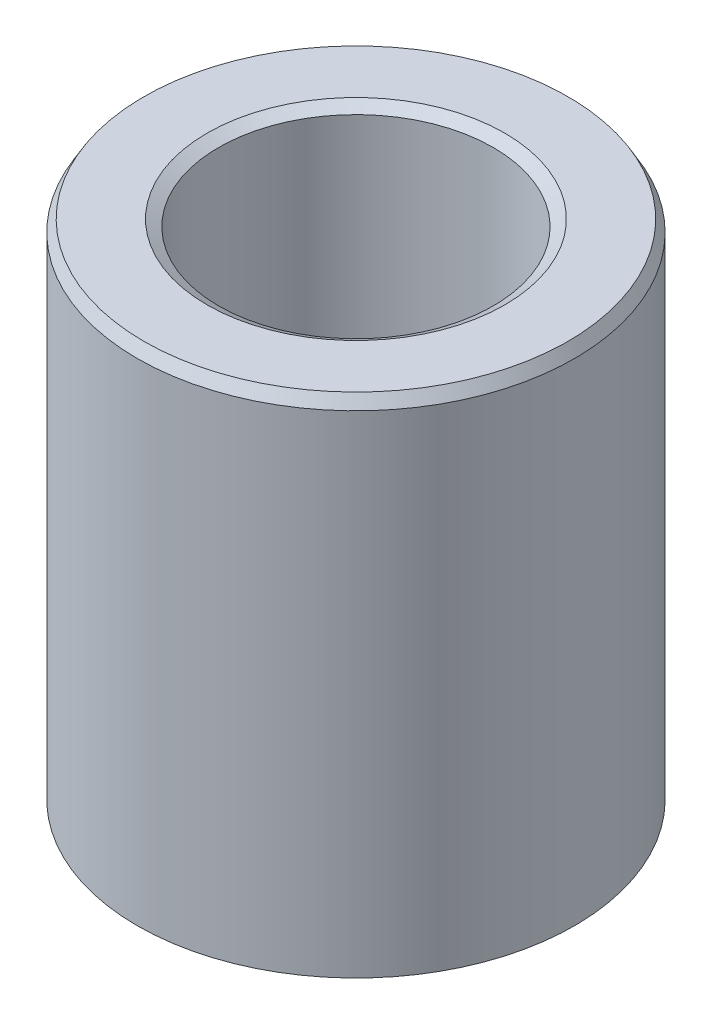
from build123d import *
from OCP.BRepFilletAPI import BRepFilletAPI_MakeChamfer

# Parameters (mm, degrees)
SKETCH1_R           = 57.5
BOSS_EXTRUDE1_DEPTH = 133.977435346
SKETCH2_R           = 36.108067693
CUT_EXTRUDE1_DEPTH  = 157.724130822
CHAMFER1_SIZE       = 3.031612927
CHAMFER1_SIZE2      = 1.750302539


with BuildPart() as part:
    # Sketch1 → Boss-Extrude1 (new body)
    with BuildSketch(Plane(origin=(0, 0, 0), x_dir=(1, 0, 0), z_dir=(0, 1, 0))):
        Circle(SKETCH1_R)
    extrude(amount=BOSS_EXTRUDE1_DEPTH)

    # Sketch2 → Cut-Extrude1 (cut, through all)
    with BuildSketch(Plane(origin=(0, 0, 0), x_dir=(1, 0, 0), z_dir=(0, 1, 0))):
        Circle(SKETCH2_R)
    extrude(amount=CUT_EXTRUDE1_DEPTH, mode=Mode.SUBTRACT)

    # Chamfer1: one chamfer whose edges measure the first distance from different faces: ONE call of the kernel's chamfer builder (chamfer() names one face for all edges)
    chamfer1_edges_1 = [part.edges().sort_by_distance(p)[0] for p in [
        (-36.108067693, 133.977435346, 0),
    ]]
    chamfer1_side_1 = [part.faces().sort_by_distance(p)[0] for p in [
        (-55.873654403, 133.977435346, 0),
    ]]
    chamfer1_edges_2 = [part.edges().sort_by_distance(p)[0] for p in [
        (-36.108067693, 0, 0),
    ]]
    chamfer1_side_2 = [part.faces().sort_by_distance(p)[0] for p in [
        (-36.108067693, 66.988717673, 0),
    ]]
    chamfer1_edges_3 = [part.edges().sort_by_distance(p)[0] for p in [
        (-57.5, 0, 0),
    ]]
    chamfer1_side_3 = [part.faces().sort_by_distance(p)[0] for p in [
        (-55.873654403, 0, 0),
    ]]
    chamfer1_edges_4 = [part.edges().sort_by_distance(p)[0] for p in [
        (-57.5, 133.977435346, 0),
    ]]
    chamfer1_side_4 = [part.faces().sort_by_distance(p)[0] for p in [
        (-57.5, 66.988717673, 0),
    ]]
    chamfer1 = BRepFilletAPI_MakeChamfer(part.part.solid().wrapped)
    for e in chamfer1_edges_1:
        chamfer1.Add(CHAMFER1_SIZE, CHAMFER1_SIZE2, e.wrapped, chamfer1_side_1[0].wrapped)  # the first distance lies on this face
    for e in chamfer1_edges_2:
        chamfer1.Add(CHAMFER1_SIZE, CHAMFER1_SIZE2, e.wrapped, chamfer1_side_2[0].wrapped)  # the first distance lies on this face
    for e in chamfer1_edges_3:
        chamfer1.Add(CHAMFER1_SIZE, CHAMFER1_SIZE2, e.wrapped, chamfer1_side_3[0].wrapped)  # the first distance lies on this face
    for e in chamfer1_edges_4:
        chamfer1.Add(CHAMFER1_SIZE, CHAMFER1_SIZE2, e.wrapped, chamfer1_side_4[0].wrapped)  # the first distance lies on this face
    add(Compound.cast(chamfer1.Shape()), mode=Mode.REPLACE)


solid = part.part
